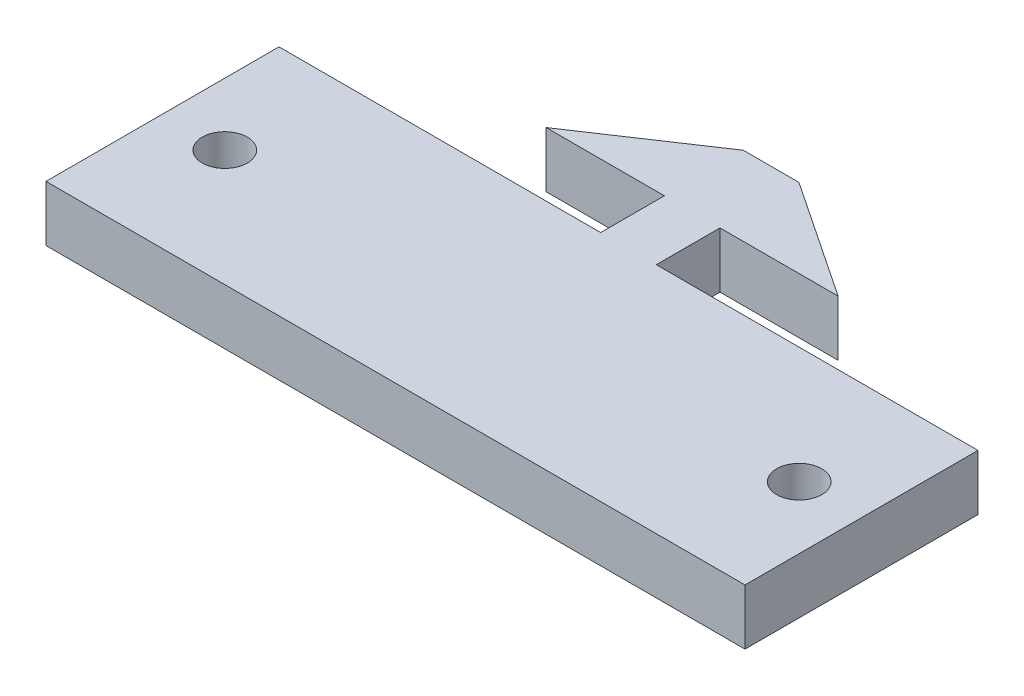
from build123d import *

# Parameters (mm, degrees)
BOSS_EXTRUDE1_DEPTH = 3.5814
SKETCH2_R           = 1.45
CUT_EXTRUDE1_DEPTH  = 29.456614801


with BuildPart() as part:
    # Sketch1 → Boss-Extrude1 (new body)
    with BuildSketch(Plane(origin=(0, 0, 0), x_dir=(1, 0, 0), z_dir=(0, 1, 0))):
        Polygon((-9.398, 2.05), (-1.7907, 2.05), (-1.7907, -2.05), (-22.5, -2.05), (-22.5, -17.05), (22.5, -17.05), (22.5, -2.05), (1.7907, -2.05), (1.7907, 2.05), (9.398, 2.05), (1.7907, 7.13), (-1.7907, 7.13), align=None)
    extrude(amount=BOSS_EXTRUDE1_DEPTH)

    # Sketch2 → Cut-Extrude1 (cut, through all)
    with BuildSketch(Plane(origin=(0, 3.5814, 0), x_dir=(1, 0, 0), z_dir=(0, 1, 0))):
        with Locations((-18.49, -9.55)):
            Circle(SKETCH2_R)
        with Locations((18.49, -9.55)):
            Circle(SKETCH2_R)
    extrude(amount=-CUT_EXTRUDE1_DEPTH, mode=Mode.SUBTRACT)


solid = part.part
